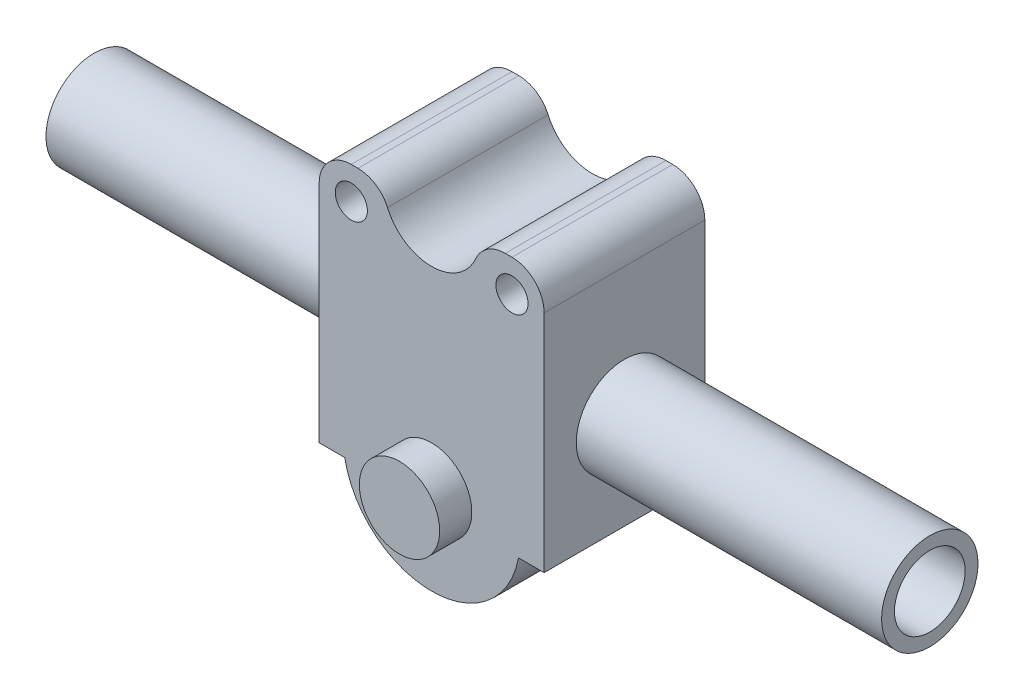
from build123d import *

# Parameters (mm, degrees)
SKETCH1_R           = 5
BOSS_EXTRUDE2_DEPTH = 50
SHELL2_START        = 5
SHELL2_DEPTH        = 40
SKETCH3_R           = 15
CUT_EXTRUDE1_DEPTH  = 5
BOSS_EXTRUDE3_START = 10
SKETCH4_R           = 27.5
SKETCH4_R_2         = 6
BOSS_EXTRUDE3_DEPTH = 10
SKETCH5_R           = 15
SKETCH5_R_2         = 11
BOSS_EXTRUDE4_DEPTH = 95
CUT_EXTRUDE2_START  = -80
SKETCH5_2_R         = 11
CUT_EXTRUDE2_DEPTH  = 80
BOSS_EXTRUDE5_START = -165
SKETCH5_3_R         = 15
SKETCH5_3_R_2       = 11
BOSS_EXTRUDE5_DEPTH = 95
SKETCH6_R           = 12.5
SKETCH6_R_2         = 6
BOSS_EXTRUDE6_DEPTH = 5
CUT_EXTRUDE3_START  = -5
SKETCH6_2_R         = 6
CUT_EXTRUDE3_DEPTH  = 5
BOSS_EXTRUDE7_START = -38
SKETCH6_3_R         = 12.5
SKETCH6_3_R_2       = 6
BOSS_EXTRUDE7_DEPTH = 38
SKETCH6_4_R         = 12.5
SKETCH6_4_R_2       = 6
BOSS_EXTRUDE8_DEPTH = 10


# Read off the part's stored shape, not the designer's step: Shell2
with BuildPart() as part:
    # Sketch1 → Boss-Extrude2 (new body)
    with BuildSketch(Plane.XY):
        with BuildLine():
            Line((22.912878475, 75), (25, 75))
            ThreePointArc((25, 75), (32.071067812, 72.071067812), (35, 65))
            Line((35, 65), (35, -5))
            Line((35, -5), (27.041634566, -5))
            ThreePointArc((27.041634566, -5), (0, -27.5), (-27.041634566, -5))
            Line((-27.041634566, -5), (-35, -5))
            Line((-35, -5), (-35, 65))
            ThreePointArc((-35, 65), (-32.071067812, 72.071067812), (-25, 75))
            Line((-25, 75), (-22.912878475, 75))
            ThreePointArc((-22.912878475, 75), (-17.4356529, 73.366600265), (-13.747727085, 69))
            ThreePointArc((-13.747727085, 69), (0, 60), (13.747727085, 69))
            ThreePointArc((13.747727085, 69), (17.4356529, 73.366600265), (22.912878475, 75))
        make_face()
        with Locations((-25, 65)):
            Circle(SKETCH1_R, mode=Mode.SUBTRACT)
        with Locations((25, 65)):
            Circle(SKETCH1_R, mode=Mode.SUBTRACT)
    extrude(amount=BOSS_EXTRUDE2_DEPTH)

    # Shell2 outline → Shell2 (cut)
    with BuildSketch(Plane.XY.offset(SHELL2_START)):
        with BuildLine():
            Line((30, 0), (30, 56.339745962))
            ThreePointArc((30, 56.339745962), (21.260998255, 55.725310466), (15.391593697, 62.228984243))
            ThreePointArc((15.391593697, 62.228984243), (0, 55), (-15.391593697, 62.228984243))
            ThreePointArc((-15.391593697, 62.228984243), (-21.260998255, 55.725310466), (-30, 56.339745962))
            Line((-30, 56.339745962), (-30, 0))
            Line((-30, 0), (-22.5, 0))
            ThreePointArc((-22.5, 0), (0, -22.5), (22.5, 0))
            Line((22.5, 0), (30, 0))
        make_face()
    extrude(amount=SHELL2_DEPTH, mode=Mode.SUBTRACT)

    # Sketch3 → Cut-Extrude1 (cut)
    with BuildSketch(Plane(origin=(0, 0, 0), x_dir=(-1, 0, 0), z_dir=(0, 0, -1))):
        Circle(SKETCH3_R)
    extrude(amount=-CUT_EXTRUDE1_DEPTH, mode=Mode.SUBTRACT)

    # Sketch4 → Boss-Extrude3 (add)
    with BuildSketch(Plane(origin=(0, 0, 0), x_dir=(-1, 0, 0), z_dir=(0, 0, -1)).offset(BOSS_EXTRUDE3_START)):
        Circle(SKETCH4_R)
        Circle(SKETCH4_R_2, mode=Mode.SUBTRACT)
    extrude(amount=-BOSS_EXTRUDE3_DEPTH)

    # Sketch5 → Boss-Extrude4 (add)
    with BuildSketch(Plane(origin=(35, 0, 0), x_dir=(0, 0, -1), z_dir=(1, 0, 0))):
        with Locations(Location((-25, 25, 0), (0, 0, 270))):
            Circle(SKETCH5_R)
        with Locations(Location((-25, 25, 0), (0, 0, 90))):
            Circle(SKETCH5_R_2, mode=Mode.SUBTRACT)
    extrude(amount=BOSS_EXTRUDE4_DEPTH)

    # Sketch5<2> → Cut-Extrude2 (cut)
    with BuildSketch(Plane(origin=(35, 0, 0), x_dir=(0, 0, -1), z_dir=(1, 0, 0)).offset(CUT_EXTRUDE2_START)):
        with Locations(Location((-25, 25, 0), (0, 0, 270))):
            Circle(SKETCH5_2_R)
    extrude(amount=CUT_EXTRUDE2_DEPTH, mode=Mode.SUBTRACT)

    # Sketch5<3> → Boss-Extrude5 (add)
    with BuildSketch(Plane(origin=(35, 0, 0), x_dir=(0, 0, -1), z_dir=(1, 0, 0)).offset(BOSS_EXTRUDE5_START)):
        with Locations(Location((-25, 25, 0), (0, 0, 270))):
            Circle(SKETCH5_3_R)
        with Locations(Location((-25, 25, 0), (0, 0, 270))):
            Circle(SKETCH5_3_R_2, mode=Mode.SUBTRACT)
    extrude(amount=BOSS_EXTRUDE5_DEPTH)

    # Sketch6 → Boss-Extrude6 (add)
    with BuildSketch(Plane.XY.offset(50)):
        with Locations(Location((0, 0, 0), (0, 0, 180))):
            Circle(SKETCH6_R)
        with Locations(Location((0, 0, 0), (0, 0, 180))):
            Circle(SKETCH6_R_2, mode=Mode.SUBTRACT)
    extrude(amount=BOSS_EXTRUDE6_DEPTH)

    # Sketch6<2> → Cut-Extrude3 (cut)
    with BuildSketch(Plane.XY.offset(50).offset(CUT_EXTRUDE3_START)):
        with Locations(Location((0, 0, 0), (0, 0, 180))):
            Circle(SKETCH6_2_R)
    extrude(amount=CUT_EXTRUDE3_DEPTH, mode=Mode.SUBTRACT)

    # Sketch6<3> → Boss-Extrude7 (add)
    with BuildSketch(Plane.XY.offset(50).offset(BOSS_EXTRUDE7_START)):
        with Locations(Location((0, 0, 0), (0, 0, 180))):
            Circle(SKETCH6_3_R)
        with Locations(Location((0, 0, 0), (0, 0, 180))):
            Circle(SKETCH6_3_R_2, mode=Mode.SUBTRACT)
    extrude(amount=BOSS_EXTRUDE7_DEPTH)

    # Sketch6<4> → Boss-Extrude8 (add)
    # profile 1 of 2: a face of its own
    with BuildSketch(Plane.XY.offset(50)):
        with Locations(Location((0, 0, 0), (0, 0, 180))):
            Circle(SKETCH6_4_R)
        Circle(SKETCH6_4_R_2, mode=Mode.SUBTRACT)
    # profile 2 of 2: a face of its own
    with BuildSketch(Plane.XY.offset(50)):
        Circle(SKETCH6_4_R_2)
    extrude(amount=BOSS_EXTRUDE8_DEPTH)


solid = part.part
